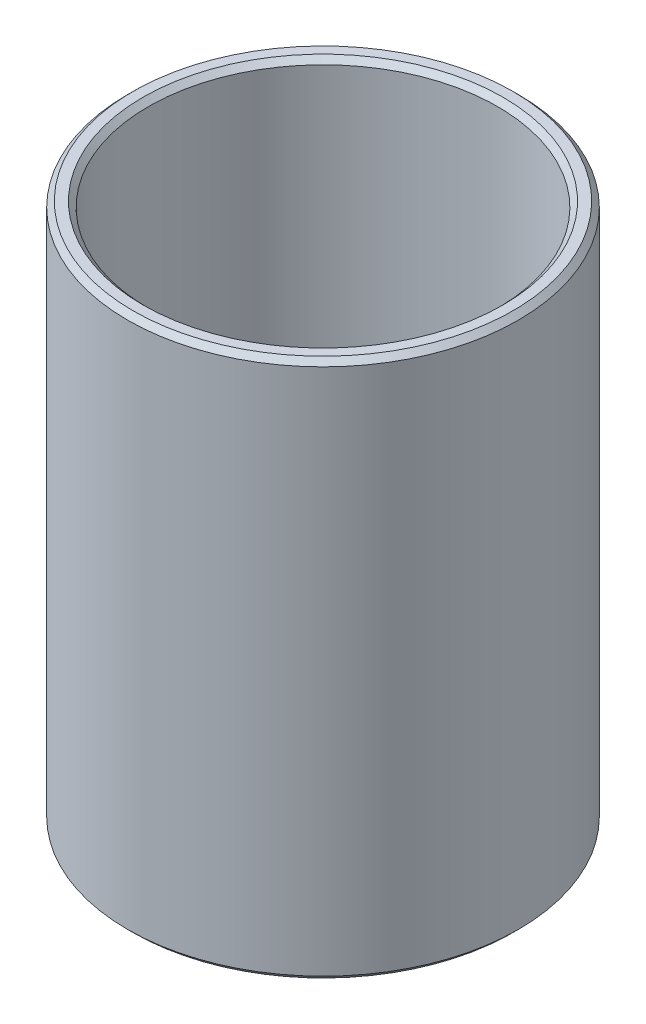
from build123d import *

# Parameters (mm, degrees)
SKETCH1_R           = 60
BOSS_EXTRUDE1_DEPTH = 165.358222998
SKETCH2_R           = 53.611578801
CUT_EXTRUDE1_DEPTH  = 186.858392098
CHAMFER1_SIZE       = 1.660994405


with BuildPart() as part:
    # Sketch1 → Boss-Extrude1 (new body)
    with BuildSketch(Plane(origin=(0, 0, 0), x_dir=(1, 0, 0), z_dir=(0, 1, 0))):
        Circle(SKETCH1_R)
    extrude(amount=BOSS_EXTRUDE1_DEPTH)

    # Sketch2 → Cut-Extrude1 (cut, through all)
    with BuildSketch(Plane(origin=(0, 0, 0), x_dir=(1, 0, 0), z_dir=(0, 1, 0))):
        Circle(SKETCH2_R)
    extrude(amount=CUT_EXTRUDE1_DEPTH, mode=Mode.SUBTRACT)

    # Chamfer1
    chamfer1_edges = [part.edges().sort_by_distance(p)[0] for p in [
        (-53.611578801, 165.358222998, 0),
        (-53.611578801, 0, 0),
        (-60, 0, 0),
        (-60, 165.358222998, 0),
    ]]
    chamfer(chamfer1_edges, length=CHAMFER1_SIZE)


solid = part.part
